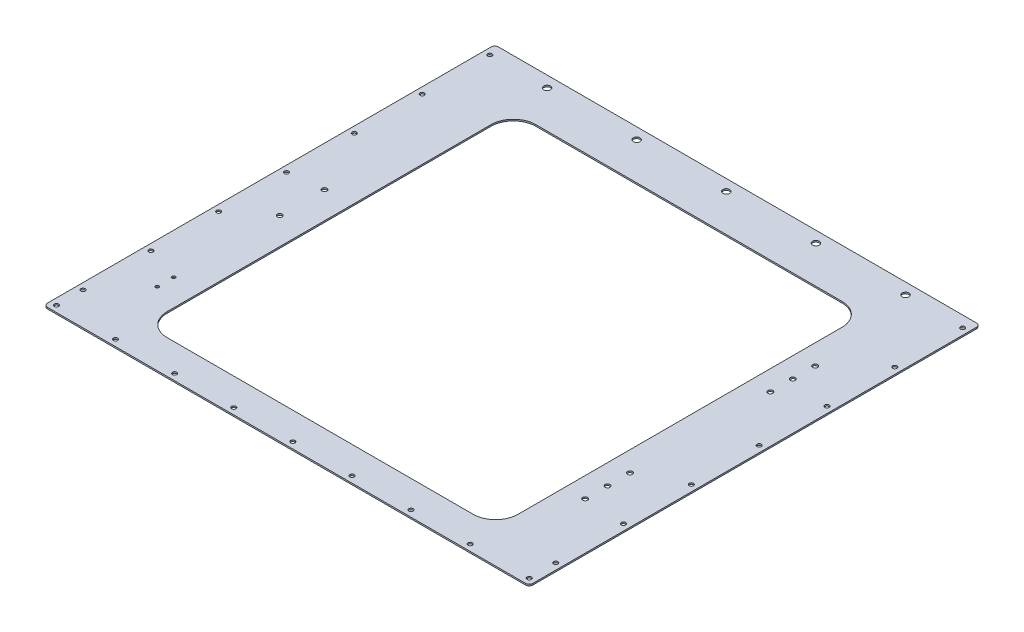
from build123d import *

# Parameters (mm, degrees)
SKETCH1_W            = 650
SKETCH1_H            = 603.9
BASE_FLANGE1_DEPTH   = 2
M8_CLEARANCE_HOLE1_D = 9
CUT_EXTRUDE1_DEPTH   = 10
M6_CLEARANCE_HOLE1_D = 6.6
M6_CLEARANCE_HOLE2_D = 6.6
M5_CLEARANCE_HOLE1_D = 5.8
M5_CLEARANCE_HOLE2_D = 5.8
M4_CLEARANCE_HOLE1_D = 4.5
FILLET1_R            = 5


# Sheet-metal steps are written as plain solids
with BuildPart() as part:
    # Sketch1 → Base-Flange1 (new body)
    with BuildSketch(Plane(origin=(0, 0, 0), x_dir=(1, 0, 0), z_dir=(0, 1, 0))):
        Rectangle(SKETCH1_W, SKETCH1_H)
    extrude(amount=-BASE_FLANGE1_DEPTH)

    # M8 Clearance Hole1 (through all)
    with Locations(Plane(origin=(0, 0, 0), x_dir=(1, 0, 0), z_dir=(0, 1, 0))):
        with Locations((240, 286.95), (120, 286.95), (0, 286.95), (-240, 286.95), (-120, 286.95)):
            Hole(M8_CLEARANCE_HOLE1_D / 2)

    # Sketch8 → Cut-Extrude1 (cut)
    with BuildSketch(Plane(origin=(0, 0, 0), x_dir=(1, 0, 0), z_dir=(0, 1, 0))):
        with BuildLine():
            Line((205, 236.95), (-205, 236.95))
            ThreePointArc((-205, 236.95), (-226.213203436, 228.163203436), (-235, 206.95))
            Line((-235, 206.95), (-235, -226.95))
            ThreePointArc((-235, -226.95), (-226.213203436, -248.163203436), (-205, -256.95))
            Line((-205, -256.95), (205, -256.95))
            ThreePointArc((205, -256.95), (226.213203436, -248.163203436), (235, -226.95))
            Line((235, -226.95), (235, 206.95))
            ThreePointArc((235, 206.95), (226.213203436, 228.163203436), (205, 236.95))
        make_face()
    extrude(amount=-CUT_EXTRUDE1_DEPTH, mode=Mode.SUBTRACT)

    # M6 Clearance Hole1 (through all)
    with Locations(Plane(origin=(0, 0, 0), x_dir=(1, 0, 0), z_dir=(0, 1, 0))):
        with Locations((262, -164), (262, -134), (262, -104), (262, 84), (262, 114), (262, 144)):
            Hole(M6_CLEARANCE_HOLE1_D / 2)

    # M6 Clearance Hole2 (through all)
    with Locations(Plane(origin=(0, 0, 0), x_dir=(1, 0, 0), z_dir=(0, 1, 0))):
        with Locations((-271, 20), (-271, -40)):
            Hole(M6_CLEARANCE_HOLE2_D / 2)

    # M5 Clearance Hole1 (through all)
    with Locations(Plane(origin=(0, 0, 0), x_dir=(1, 0, 0), z_dir=(0, 1, 0))):
        with Locations((-316.5, 286.95), (-316.5, 196.133333333), (-316.5, 105.316666667), (-316.5, 14.5), (-316.5, -76.316666667), (-316.5, -167.133333333), (-316.5, -257.95), (-316.5, -293.45)):
            m5_clearance_hole1 = Hole(M5_CLEARANCE_HOLE1_D / 2)

    # Mirror1: M5 Clearance Hole1 across plane
    add(m5_clearance_hole1.mirror(Plane(origin=(0, 0, 0), x_dir=(0, 0, 1), z_dir=(1, 0, 0))), mode=Mode.SUBTRACT)

    # M5 Clearance Hole2 (through all)
    with Locations(Plane(origin=(0, 0, 0), x_dir=(1, 0, 0), z_dir=(0, 1, 0))):
        with Locations((-237.375, -293.45), (-158.25, -293.45), (-79.125, -293.45), (0, -293.45), (79.125, -293.45), (158.25, -293.45), (237.375, -293.45)):
            Hole(M5_CLEARANCE_HOLE2_D / 2)

    # M4 Clearance Hole1 (through all)
    with Locations(Plane(origin=(0, 0, 0), x_dir=(1, 0, 0), z_dir=(0, 1, 0))):
        with Locations((-270.6, -182.533005244), (-270.6, -204.533005244)):
            Hole(M4_CLEARANCE_HOLE1_D / 2)

    # Fillet1
    fillet1_edges = [part.edges().sort_by_distance(p)[0] for p in [
        (-325, -1, -301.95),
        (325, -1, -301.95),
        (325, -1, 301.95),
        (-325, -1, 301.95),
    ]]
    fillet(fillet1_edges, radius=FILLET1_R)


solid = part.part
